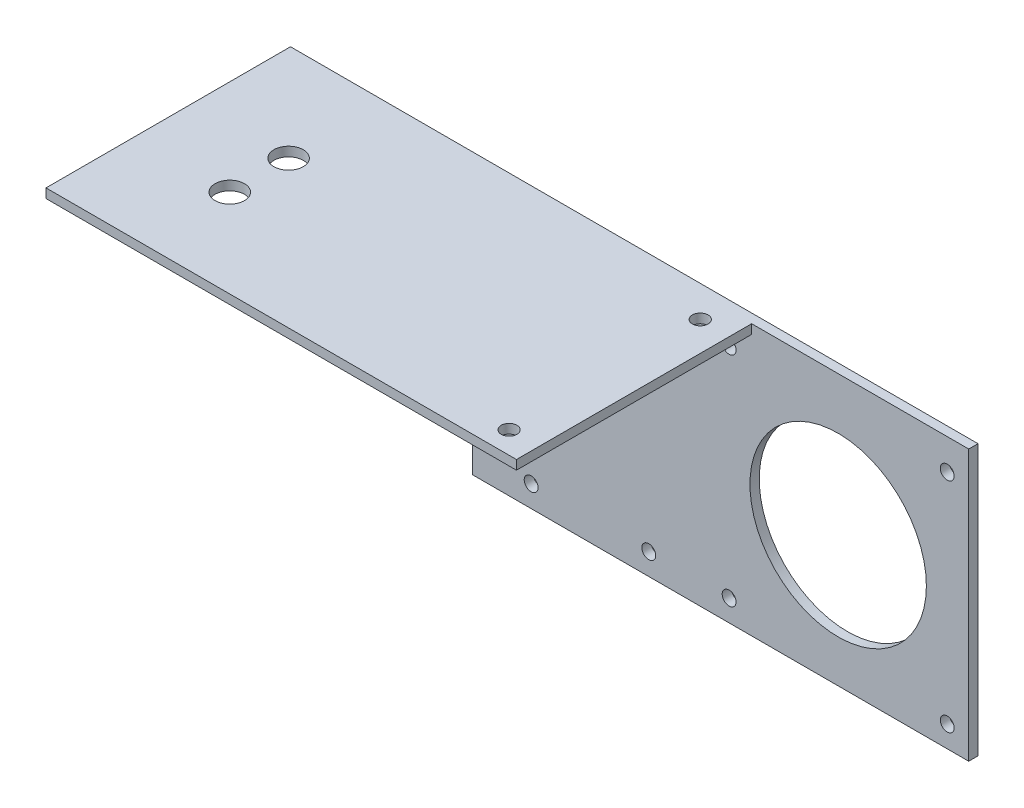
from build123d import *

# Parameters (mm, degrees)
SKETCH1_W           = 107.2
SKETCH1_H           = 58.4
SKETCH1_R           = 1.5
SKETCH1_R_2         = 19.05
BOSS_EXTRUDE1_DEPTH = 2
BOSS_EXTRUDE2_DEPTH = 52.8
SKETCH3_R           = 1.7
CUT_EXTRUDE1_DEPTH  = 133.22344724
SKETCH4_R           = 3.175
CUT_EXTRUDE2_DEPTH  = 10


with BuildPart() as part:
    # Sketch1 → Boss-Extrude1 (new body)
    with BuildSketch(Plane.XY):
        with Locations((53.6, 29.2)):
            Rectangle(SKETCH1_W, SKETCH1_H)
        with Locations((102.55, 51.75)):
            Circle(SKETCH1_R, mode=Mode.SUBTRACT)
        with Locations((102.55, 4.65)):
            Circle(SKETCH1_R, mode=Mode.SUBTRACT)
        with Locations((55.45, 4.65)):
            Circle(SKETCH1_R, mode=Mode.SUBTRACT)
        with Locations((55.45, 51.75)):
            Circle(SKETCH1_R, mode=Mode.SUBTRACT)
        with Locations((12.7, 51.75)):
            Circle(SKETCH1_R, mode=Mode.SUBTRACT)
        with Locations((38.1, 51.75)):
            Circle(SKETCH1_R, mode=Mode.SUBTRACT)
        with Locations((12.7, 4.65)):
            Circle(SKETCH1_R, mode=Mode.SUBTRACT)
        with Locations((38.1, 4.65)):
            Circle(SKETCH1_R, mode=Mode.SUBTRACT)
        with Locations((79, 28.2)):
            Circle(SKETCH1_R_2, mode=Mode.SUBTRACT)
    extrude(amount=-BOSS_EXTRUDE1_DEPTH)

    # Sketch2 → Boss-Extrude2 (add)
    with BuildSketch(Plane(origin=(0, 0, -2), x_dir=(-1, 0, 0), z_dir=(0, 0, -1))):
        Polygon((0, 58.4), (41.275, 58.4), (41.275, 56.4), (0, 56.4), (-60.325, 56.4), (-60.325, 58.4), align=None)
    extrude(amount=-BOSS_EXTRUDE2_DEPTH)

    # Sketch3 → Cut-Extrude1 (cut, through all)
    with BuildSketch(Plane(origin=(0, 58.4, 0), x_dir=(1, 0, 0), z_dir=(0, 1, 0))):
        with Locations((53.975, -4.7625)):
            Circle(SKETCH3_R)
        with Locations((53.975, -46.0375)):
            Circle(SKETCH3_R)
    extrude(amount=-CUT_EXTRUDE1_DEPTH, mode=Mode.SUBTRACT)

    # Sketch4 → Cut-Extrude2 (cut)
    with BuildSketch(Plane(origin=(0, 58.4, 0), x_dir=(1, 0, 0), z_dir=(0, 1, 0))):
        with Locations((-20.6375, -19.05)):
            Circle(SKETCH4_R)
        with Locations((-20.6375, -31.75)):
            Circle(SKETCH4_R)
    extrude(amount=-CUT_EXTRUDE2_DEPTH, mode=Mode.SUBTRACT)


solid = part.part
